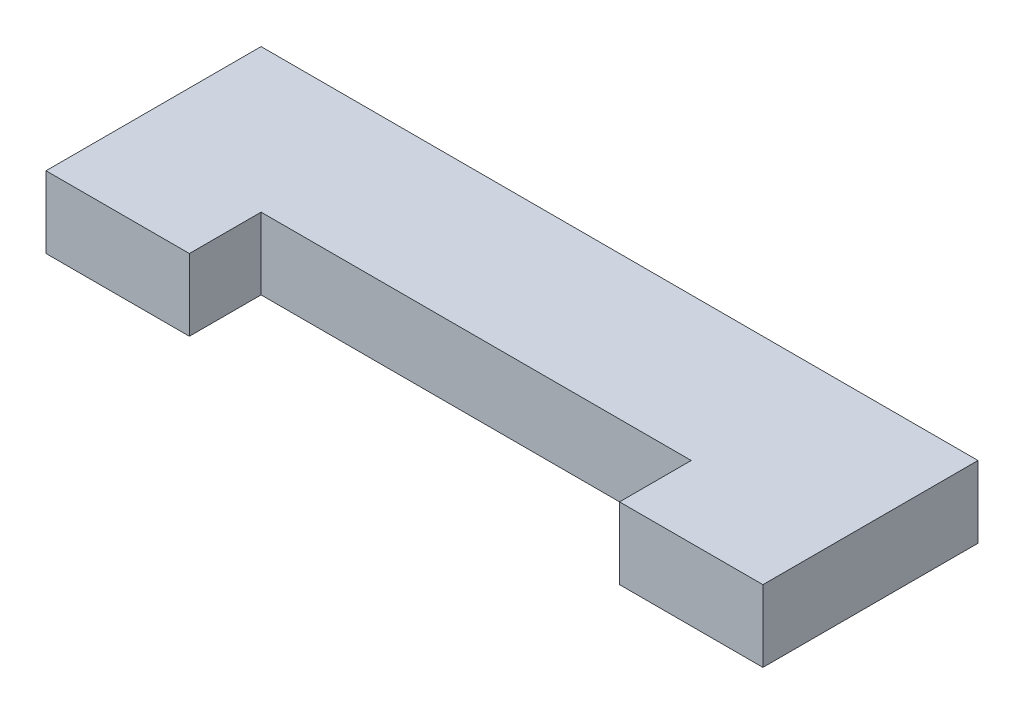
from build123d import *

# Parameters (mm, degrees)
BOSS_EXTRUDE1_DEPTH = 4


with BuildPart() as part:
    # Sketch1 → Boss-Extrude1 (new body)
    with BuildSketch(Plane(origin=(0, 0, 0), x_dir=(1, 0, 0), z_dir=(0, 1, 0))):
        Polygon((-20, -4), (-20, -8), (-12, -8), (-12, -4), (12, -4), (12, -8), (20, -8), (20, -4), (20, 4), (-20, 4), align=None)
    extrude(amount=BOSS_EXTRUDE1_DEPTH)


solid = part.part
